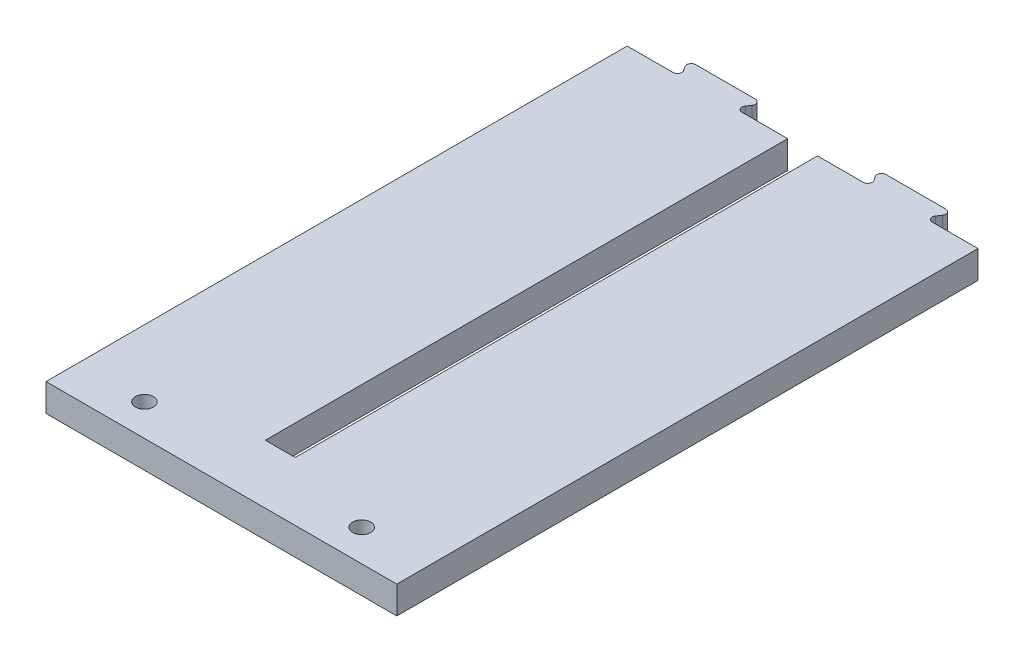
from build123d import *

# Parameters (mm, degrees)
SKETCH1_W           = 38.75
SKETCH1_H           = 72.5
BOSS_EXTRUDE1_DEPTH = 3.05
SKETCH4_W           = 3.3
SKETCH4_H           = 1
SKETCH4_H_2         = 61.8
CUT_EXTRUDE1_DEPTH  = 76.106212293
SKETCH7_R           = 1
CUT_EXTRUDE4_DEPTH  = 76.106212293
SKETCH8_W           = 38.75
SKETCH8_H           = 8.3
CUT_EXTRUDE5_DEPTH  = 76.106212293
BOSS_EXTRUDE3_DEPTH = 3.05
FILLET2_R           = 0.5


with BuildPart() as part:
    # Sketch1 → Boss-Extrude1 (new body)
    with BuildSketch(Plane(origin=(0, 0, 0), x_dir=(1, 0, 0), z_dir=(0, 1, 0))):
        with Locations((0, 36.25)):
            Rectangle(SKETCH1_W, SKETCH1_H)
    extrude(amount=BOSS_EXTRUDE1_DEPTH)

    # Sketch4 → Cut-Extrude1 (cut, through all)
    with BuildSketch(Plane(origin=(0, 3.05, 0), x_dir=(1, 0, 0), z_dir=(0, 1, 0))):
        with Locations((0, 70)):
            Rectangle(SKETCH4_W, SKETCH4_H)
        with Locations((0, 37.4)):
            Rectangle(SKETCH4_W, SKETCH4_H_2)
    extrude(amount=-CUT_EXTRUDE1_DEPTH, mode=Mode.SUBTRACT)

    # Sketch7 → Cut-Extrude4 (cut, through all)
    with BuildSketch(Plane(origin=(0, 3.05, 0), x_dir=(1, 0, 0), z_dir=(0, 1, 0))):
        with Locations((-12, 3.5)):
            Circle(SKETCH7_R)
        with Locations((12, 3.5)):
            Circle(SKETCH7_R)
    extrude(amount=-CUT_EXTRUDE4_DEPTH, mode=Mode.SUBTRACT)

    # Sketch8 → Cut-Extrude5 (cut, through all)
    with BuildSketch(Plane(origin=(0, 3.05, 0), x_dir=(1, 0, 0), z_dir=(0, 1, 0))):
        with Locations((0, 68.35)):
            Rectangle(SKETCH8_W, SKETCH8_H)
    extrude(amount=-CUT_EXTRUDE5_DEPTH, mode=Mode.SUBTRACT)

    # Sketch9 → Boss-Extrude3 (add)
    with BuildSketch(Plane(origin=(0, 3.05, 0), x_dir=(1, 0, 0), z_dir=(0, 1, 0))):
        Polygon((-14.7625, 66.2), (-13.375, 64.2), (-7.65, 64.2), (-6.2625, 66.2), align=None)
        Polygon((6.2625, 66.2), (7.65, 64.2), (13.375, 64.2), (14.7625, 66.2), align=None)
    extrude(amount=-BOSS_EXTRUDE3_DEPTH)

    # Fillet2
    fillet2_edges = [part.edges().sort_by_distance(p)[0] for p in [
        (13.375, 1.525, -64.2),
        (-7.65, 1.525, -64.2),
        (14.7625, 1.525, -66.2),
        (7.65, 1.525, -64.2),
        (6.2625, 1.525, -66.2),
        (-6.2625, 1.525, -66.2),
        (-14.7625, 1.525, -66.2),
        (-13.375, 1.525, -64.2),
    ]]
    fillet(fillet2_edges, radius=FILLET2_R)


solid = part.part
